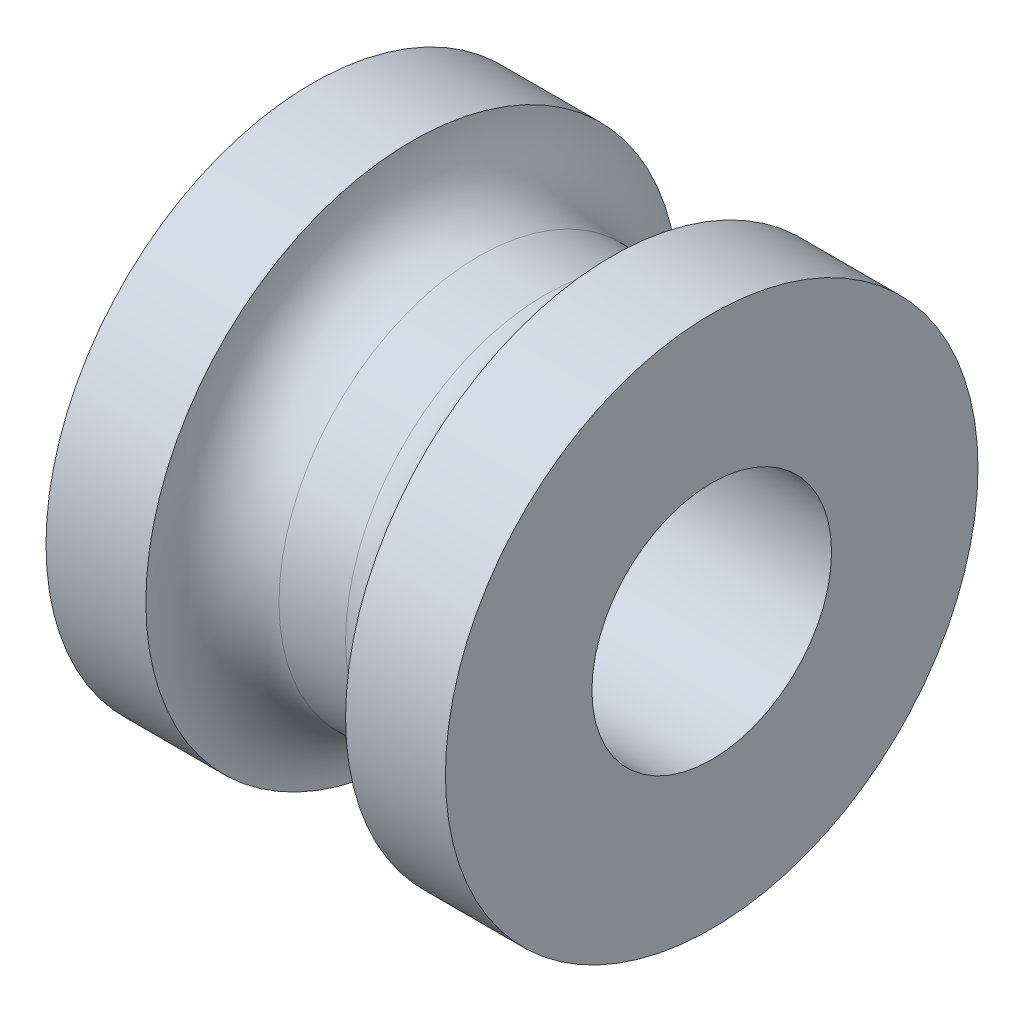
from build123d import *

# Parameters (mm, degrees)
SKETCH1_R           = 4
BOSS_EXTRUDE1_DEPTH = 1.5
SKETCH2_R           = 3
BOSS_EXTRUDE2_DEPTH = 3
SKETCH3_R           = 4
BOSS_EXTRUDE3_DEPTH = 1.5
FILLET1_R           = 1
SKETCH4_R           = 1.8
CUT_EXTRUDE1_DEPTH  = 9.246211251


with BuildPart() as part:
    # Sketch1 → Boss-Extrude1 (new body)
    with BuildSketch(Plane(origin=(0, 0, 0), x_dir=(0, 0, -1), z_dir=(1, 0, 0))):
        Circle(SKETCH1_R)
    extrude(amount=BOSS_EXTRUDE1_DEPTH)

    # Sketch2 → Boss-Extrude2 (add)
    with BuildSketch(Plane(origin=(1.5, 0, 0), x_dir=(0, 0, -1), z_dir=(1, 0, 0))):
        Circle(SKETCH2_R)
    extrude(amount=BOSS_EXTRUDE2_DEPTH)

    # Sketch3 → Boss-Extrude3 (add)
    with BuildSketch(Plane(origin=(4.5, 0, 0), x_dir=(0, 0, -1), z_dir=(1, 0, 0))):
        Circle(SKETCH3_R)
    extrude(amount=BOSS_EXTRUDE3_DEPTH)

    # Fillet1
    fillet1_edges = [part.edges().sort_by_distance(p)[0] for p in [
        (1.5, 0, 3),
        (4.5, 0, 3),
    ]]
    fillet(fillet1_edges, radius=FILLET1_R - 0.0001)  # a hair under: the kernel refuses the full size

    # Sketch4 → Cut-Extrude1 (cut, through all)
    with BuildSketch(Plane.ZY):
        Circle(SKETCH4_R)
    extrude(amount=-CUT_EXTRUDE1_DEPTH, mode=Mode.SUBTRACT)


solid = part.part
